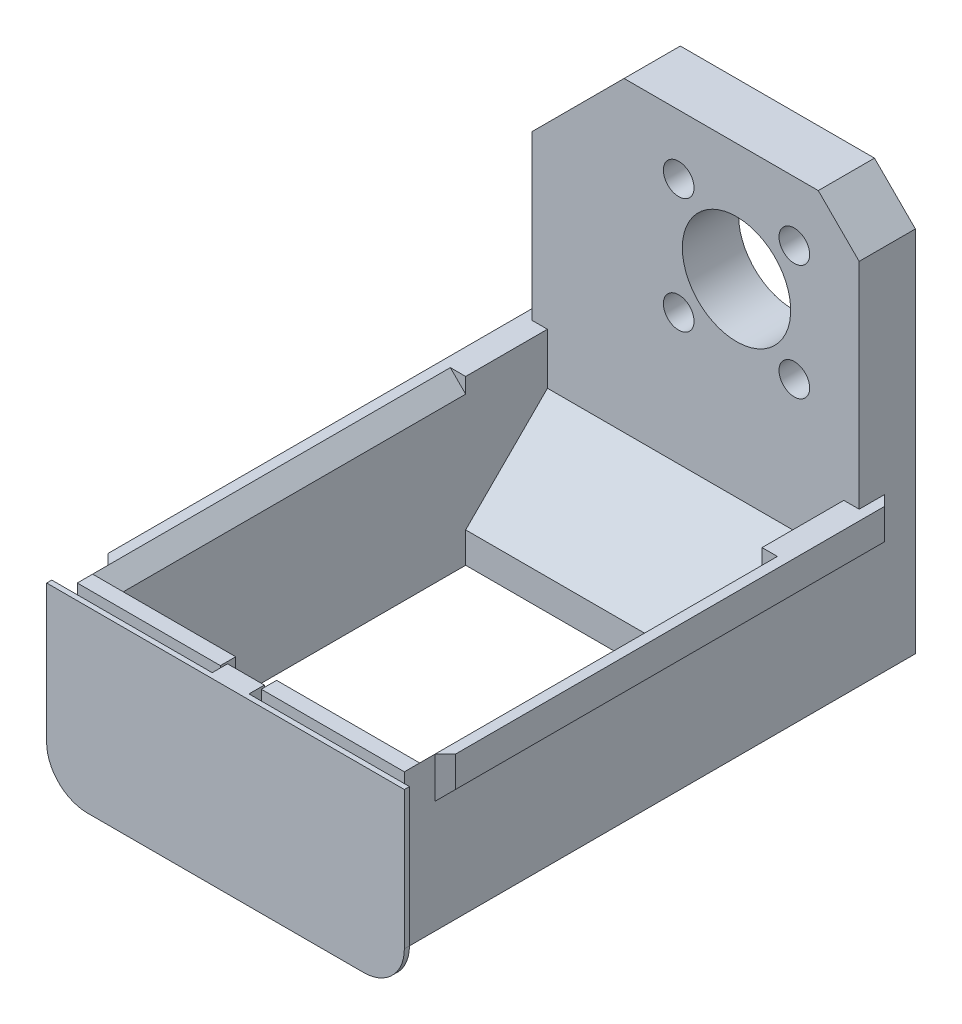
from build123d import *

# Parameters (mm, degrees)
SZKIC1_W                    = 34
SZKIC1_H                    = 50
DODANIE_WYCI_GNI_CIE1_DEPTH = 17
SZKIC3_W                    = 34
SZKIC3_H                    = 5.5
DODANIE_WYCI_GNI_CIE2_DEPTH = 25
SZKIC4_R                    = 1.5
SZKIC4_R_2                  = 5.3
WYTNIJ_WYCI_GNI_CIE2_DEPTH  = 25
SFAZOWANIE1_SIZE            = 10
SFAZOWANIE2_SIZE            = 5
WYTNIJ_WYCI_GNI_CIE3_START  = -50
WYTNIJ_WYCI_GNI_CIE3_DEPTH  = 50
SFAZOWANIE3_SIZE            = 1
SFAZOWANIE4_SIZE            = 1
SZKIC7_W                    = 35
SZKIC7_H                    = 17.5
DODANIE_WYCI_GNI_CIE3_DEPTH = 0.5
ZAOKR_GLENIE3_R             = 4
SZKIC8_W                    = 1
SZKIC8_H                    = 3
WYTNIJ_WYCI_GNI_CIE4_DEPTH  = 68
SFAZOWANIE6_SIZE            = 1
SZKIC9_W                    = 29
SZKIC9_H                    = 35
WYTNIJ_WYCI_GNI_CIE5_DEPTH  = 68
SFAZOWANIE7_SIZE            = 1.5
SZKIC10_W                   = 4
SZKIC10_H                   = 4
WYTNIJ_WYCI_GNI_CIE6_DEPTH  = 10
SZKIC11_W                   = 3.6
SZKIC11_H                   = 1.8
DODANIE_WYCI_GNI_CIE4_DEPTH = 1.5
SZKIC12_W                   = 29
SZKIC12_H                   = 10
WYTNIJ_WYCI_GNI_CIE7_DEPTH  = 8
SFAZOWANIE8_SIZE            = 8
SZKIC13_W                   = 4
SZKIC13_H                   = 2
WYTNIJ_WYCI_GNI_CIE8_DEPTH  = 2


# Read off the part's stored shape, not the designer's step: Wytnij-wyciągnięcie3
with BuildPart() as part:
    # Szkic1 → Dodanie-wyciągnięcie1 (new body)
    with BuildSketch(Plane(origin=(0, 0, 0), x_dir=(1, 0, 0), z_dir=(0, 1, 0))):
        Rectangle(SZKIC1_W, SZKIC1_H)
    extrude(amount=DODANIE_WYCI_GNI_CIE1_DEPTH)

    # Szkic3 → Dodanie-wyciągnięcie2 (add)
    with BuildSketch(Plane(origin=(0, 17, 0), x_dir=(1, 0, 0), z_dir=(0, 1, 0))):
        with Locations((0, 22.25)):
            Rectangle(SZKIC3_W, SZKIC3_H)
    extrude(amount=DODANIE_WYCI_GNI_CIE2_DEPTH)

    # Szkic4 → Wytnij-wyciągnięcie2 (cut)
    with BuildSketch(Plane(origin=(0, 0, -25), x_dir=(-1, 0, 0), z_dir=(0, 0, -1))):
        with Locations((1.656854249, 36.156854249)):
            Circle(SZKIC4_R)
        with Locations((-4, 30.5)):
            Circle(SZKIC4_R_2)
        with Locations((-9.656854249, 36.156854249)):
            Circle(SZKIC4_R)
        with Locations((1.656854249, 24.843145751)):
            Circle(SZKIC4_R)
        with Locations((-9.656854249, 24.843145751)):
            Circle(SZKIC4_R)
    extrude(amount=-WYTNIJ_WYCI_GNI_CIE2_DEPTH, mode=Mode.SUBTRACT)

    # Sfazowanie1
    sfazowanie1_edges = [part.edges().sort_by_distance(p)[0] for p in [
        (-17, 42, -22.25),
    ]]
    chamfer(sfazowanie1_edges, length=SFAZOWANIE1_SIZE)

    # Sfazowanie2
    sfazowanie2_edges = [part.edges().sort_by_distance(p)[0] for p in [
        (17, 42, -22.25),
    ]]
    chamfer(sfazowanie2_edges, length=SFAZOWANIE2_SIZE)

    # Wytnij-wyciągnięcie3 outline → Wytnij-wyciągnięcie3 (cut)
    with BuildSketch(Plane.XY.offset(25).offset(WYTNIJ_WYCI_GNI_CIE3_START)):
        Polygon((16, 38), (16, 17), (17, 17), (17, 37), align=None)
        Polygon((-17, 17), (-16, 17), (-16, 33), (-17, 32), align=None)
        Polygon((17, 0), (17, 14), (16, 14), (16, 1), (-16, 1), (-16, 14), (-17, 14), (-17, 0), align=None)
    extrude(amount=WYTNIJ_WYCI_GNI_CIE3_DEPTH, mode=Mode.SUBTRACT)

    # Sfazowanie3
    sfazowanie3_edges = [part.edges().sort_by_distance(p)[0] for p in [
        (-16, 14, 0),
        (16, 14, 0),
    ]]
    chamfer(sfazowanie3_edges, length=SFAZOWANIE3_SIZE - 0.0001)  # a hair under: the kernel refuses the full size

    # Sfazowanie4
    sfazowanie4_edges = [part.edges().sort_by_distance(p)[0] for p in [
        (-16, 1, 0),
        (16, 1, 0),
    ]]
    chamfer(sfazowanie4_edges, length=SFAZOWANIE4_SIZE)

    # Szkic8 → Wytnij-wyciągnięcie4 (cut)
    with BuildSketch(Plane(origin=(0, 17, 0), x_dir=(1, 0, 0), z_dir=(0, 1, 0))):
        with Locations((-16.5, 23.5)):
            Rectangle(SZKIC8_W, SZKIC8_H)
        with Locations((16.5, 23.5)):
            Rectangle(SZKIC8_W, SZKIC8_H)
        with Locations((-16.5, -23.5)):
            Rectangle(SZKIC8_W, SZKIC8_H)
        with Locations((16.5, -23.5)):
            Rectangle(SZKIC8_W, SZKIC8_H)
    extrude(amount=-WYTNIJ_WYCI_GNI_CIE4_DEPTH, mode=Mode.SUBTRACT)

    # Sfazowanie6
    sfazowanie6_edges = [part.edges().sort_by_distance(p)[0] for p in [
        (-17, 15.5, -22),
        (17, 15.5, -22),
        (17, 15.5, 22),
        (-17, 15.5, 22),
    ]]
    chamfer(sfazowanie6_edges, length=SFAZOWANIE6_SIZE - 0.0001)  # a hair under: the kernel refuses the full size

    # Szkic9 → Wytnij-wyciągnięcie5 (cut)
    with BuildSketch(Plane(origin=(0, 17, 0), x_dir=(1, 0, 0), z_dir=(0, 1, 0))):
        with Locations((0, -6)):
            Rectangle(SZKIC9_W, SZKIC9_H)
    extrude(amount=-WYTNIJ_WYCI_GNI_CIE5_DEPTH, mode=Mode.SUBTRACT)

    # Sfazowanie7
    sfazowanie7_edges = [part.edges().sort_by_distance(p)[0] for p in [
        (-14.5, 17, 6),
        (14.5, 17, 6),
    ]]
    chamfer(sfazowanie7_edges, length=SFAZOWANIE7_SIZE - 0.0001)  # a hair under: the kernel refuses the full size

    # Szkic10 → Wytnij-wyciągnięcie6 (cut)
    with BuildSketch(Plane.XY.offset(25)):
        with Locations((0, 17)):
            Rectangle(SZKIC10_W, SZKIC10_H)
    extrude(amount=-WYTNIJ_WYCI_GNI_CIE6_DEPTH, mode=Mode.SUBTRACT)

    # Szkic12 → Wytnij-wyciągnięcie7 (cut)
    with BuildSketch(Plane.XY.offset(-11.5)):
        with Locations((0, 17)):
            Rectangle(SZKIC12_W, SZKIC12_H)
    extrude(amount=-WYTNIJ_WYCI_GNI_CIE7_DEPTH, mode=Mode.SUBTRACT)

    # Sfazowanie8
    sfazowanie8_edges = [part.edges().sort_by_distance(p)[0] for p in [
        (0, 12, -11.5),
    ]]
    chamfer(sfazowanie8_edges, length=SFAZOWANIE8_SIZE - 0.0001)  # a hair under: the kernel refuses the full size

    # Szkic13 → Wytnij-wyciągnięcie8 (cut)
    with BuildSketch(Plane(origin=(0, 0, -25), x_dir=(-1, 0, 0), z_dir=(0, 0, -1))):
        with Locations((0, 16)):
            Rectangle(SZKIC13_W, SZKIC13_H)
    extrude(amount=-WYTNIJ_WYCI_GNI_CIE8_DEPTH, mode=Mode.SUBTRACT)


with BuildPart() as body_2:
    # Szkic7 → Dodanie-wyciągnięcie3 (new body)
    with BuildSketch(Plane.XY.offset(26)):
        with Locations((0, 8.25)):
            Rectangle(SZKIC7_W, SZKIC7_H)
    extrude(amount=DODANIE_WYCI_GNI_CIE3_DEPTH)

    # Zaokrąglenie3
    zaokr_glenie3_edges = [body_2.edges().sort_by_distance(p)[0] for p in [
        (17.5, -0.5, 26.25),
        (-17.5, -0.5, 26.25),
    ]]
    fillet(zaokr_glenie3_edges, radius=ZAOKR_GLENIE3_R)

    # Szkic11 → Dodanie-wyciągnięcie4 (add)
    with BuildSketch(Plane(origin=(0, 0, 26), x_dir=(-1, 0, 0), z_dir=(0, 0, -1))):
        with Locations((0, 16.1)):
            Rectangle(SZKIC11_W, SZKIC11_H)
    extrude(amount=DODANIE_WYCI_GNI_CIE4_DEPTH)


solid = Compound([part.part, body_2.part])
